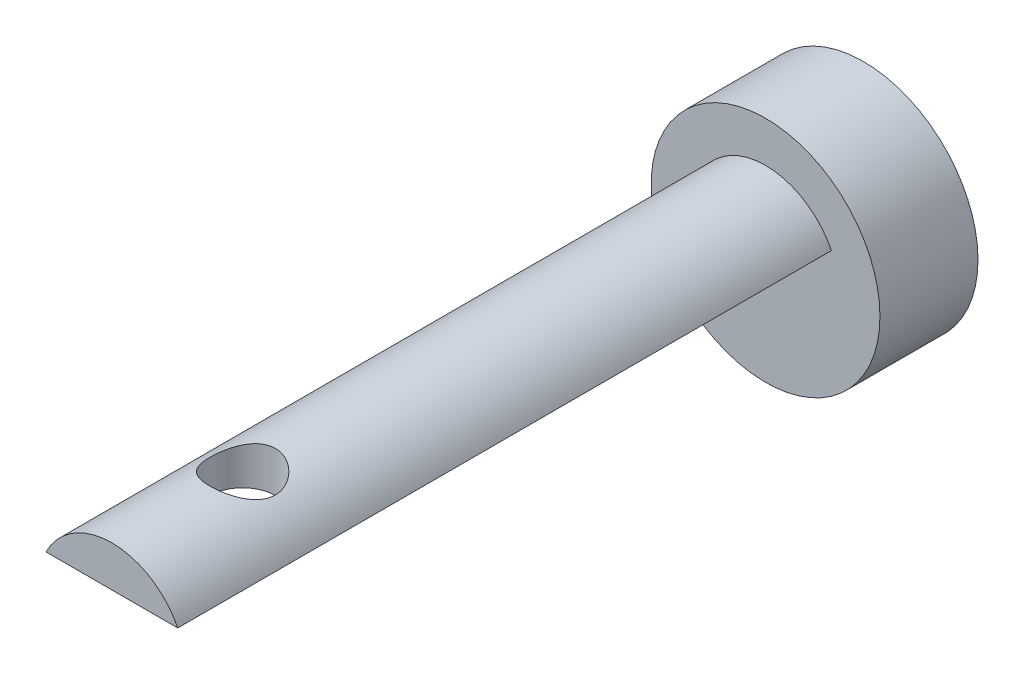
from build123d import *

# Parameters (mm, degrees)
SKETCH1_R           = 3.5
BOSS_EXTRUDE1_DEPTH = 3
BOSS_EXTRUDE2_DEPTH = 20
SKETCH3_R           = 1
CUT_EXTRUDE1_DEPTH  = 10


with BuildPart() as part:
    # Sketch1 → Boss-Extrude1 (new body)
    with BuildSketch(Plane.XY):
        Circle(SKETCH1_R)
    extrude(amount=BOSS_EXTRUDE1_DEPTH)

    # Sketch2 → Boss-Extrude2 (add)
    with BuildSketch(Plane.XY.offset(3)):
        with BuildLine():
            ThreePointArc((2.015564437, 1), (0, 2.25), (-2.015564437, 1))
            Line((-2.015564437, 1), (2.015564437, 1))
        make_face()
    extrude(amount=BOSS_EXTRUDE2_DEPTH)

    # Sketch3 → Cut-Extrude1 (cut)
    with BuildSketch(Plane(origin=(0, 1, 0), x_dir=(-1, 0, 0), z_dir=(0, -1, 0))):
        with Locations((0, -19)):
            Circle(SKETCH3_R)
    extrude(amount=-CUT_EXTRUDE1_DEPTH, mode=Mode.SUBTRACT)


solid = part.part
